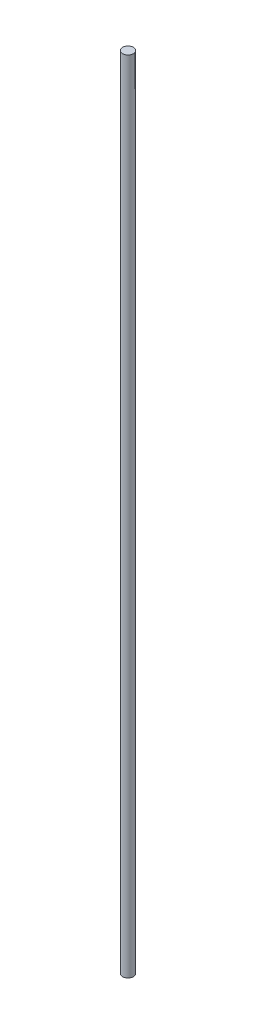
from build123d import *

# Parameters (mm, degrees)
SKETCH1_R           = 1
BOSS_EXTRUDE1_DEPTH = 145.8


with BuildPart() as part:
    # Sketch1 → Boss-Extrude1 (new body)
    with BuildSketch(Plane(origin=(0, 0, 0), x_dir=(1, 0, 0), z_dir=(0, 1, 0))):
        Circle(SKETCH1_R)
    extrude(amount=BOSS_EXTRUDE1_DEPTH)


solid = part.part
